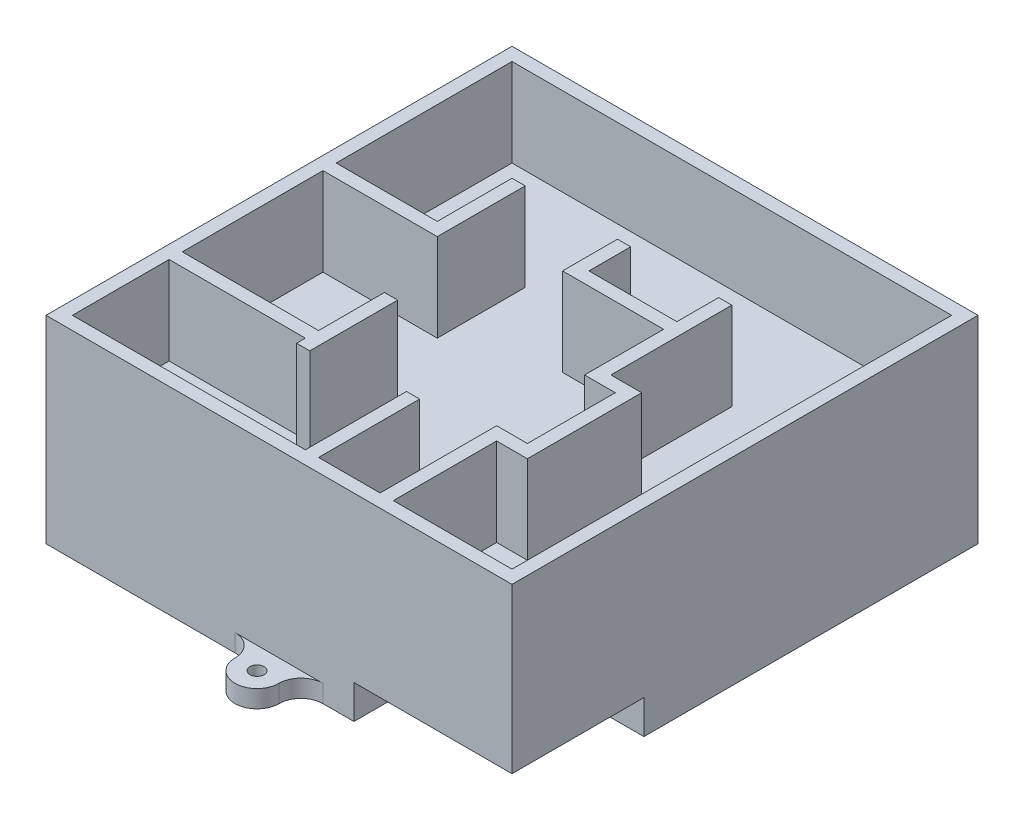
from build123d import *

# Parameters (mm, degrees)
SKETCH2_W           = 106
SKETCH2_H           = 106
SKETCH2_R           = 4
SKETCH2_R_2         = 6
BOSS_EXTRUDE1_DEPTH = 25
SKETCH3_W           = 106
SKETCH3_H           = 106
SKETCH3_W_2         = 100
SKETCH3_H_2         = 100
BOSS_EXTRUDE2_DEPTH = 20
SKETCH5_W           = 3
SKETCH5_H           = 23
BOSS_EXTRUDE3_DEPTH = 20
SKETCH7_W           = 20
SKETCH7_H           = 3
BOSS_EXTRUDE4_DEPTH = 20
SKETCH10_W          = 10
SKETCH10_H          = 4
BOSS_EXTRUDE5_DEPTH = 10
SKETCH11_W          = 10
SKETCH11_H          = 4
BOSS_EXTRUDE6_DEPTH = 10
FILLET2_RADIUS      = 5
FILLET2_LENGTH      = 4
FILLET3_R           = 5
FILLET4_R           = 5
FILLET5_R           = 5
SKETCH13_R          = 1.6
CUT_EXTRUDE2_DEPTH  = 163.397660082
SKETCH14_W          = 35.96051594
SKETCH14_H          = 7.693498276
CUT_EXTRUDE3_DEPTH  = 30


with BuildPart() as part:
    # Sketch2 → Boss-Extrude1 (new body)
    with BuildSketch(Plane(origin=(0, 0, 0), x_dir=(1, 0, 0), z_dir=(0, 1, 0))):
        with Locations((53, 53)):
            Rectangle(SKETCH2_W, SKETCH2_H)
        with Locations(Location((18, 15, 0), (0, 0, 270))):
            Circle(SKETCH2_R, mode=Mode.SUBTRACT)
        with Locations(Location((92, 13.5, 0), (0, 0, 270))):
            Circle(SKETCH2_R_2, mode=Mode.SUBTRACT)
    extrude(amount=BOSS_EXTRUDE1_DEPTH)

    # Sketch3 → Boss-Extrude2 (add)
    with BuildSketch(Plane(origin=(0, 25, 0), x_dir=(1, 0, 0), z_dir=(0, 1, 0))):
        with Locations((53, 53)):
            Rectangle(SKETCH3_W, SKETCH3_H)
        with Locations((53, 53)):
            Rectangle(SKETCH3_W_2, SKETCH3_H_2, mode=Mode.SUBTRACT)
    extrude(amount=BOSS_EXTRUDE2_DEPTH)

    # Sketch5 → Boss-Extrude3 (add)
    with BuildSketch(Plane(origin=(0, 25, 0), x_dir=(1, 0, 0), z_dir=(0, 1, 0))):
        Polygon((3, 28), (3, 25), (34, 25), (34, 23), (37, 23), (37, 43), (34, 43), (34, 28), align=None)
        Polygon((83, 52.5), (83, 26.5), (76, 26.5), (76, 3), (73, 3), (73, 29.5), (80, 29.5), (80, 49.5), (73, 49.5), (73, 52.5), align=None)
        Polygon((3, 63), (3, 60), (29, 60), (29, 80), (26, 80), (26, 63), align=None)
        with Locations((57.5, 14.5)):
            Rectangle(SKETCH5_W, SKETCH5_H)
    extrude(amount=BOSS_EXTRUDE3_DEPTH)

    # Sketch7 → Boss-Extrude4 (add)
    with BuildSketch(Plane(origin=(0, 25, 0), x_dir=(1, 0, 0), z_dir=(0, 1, 0))):
        Polygon((50, 67.496539), (53, 67.496539), (53, 70.496539), (53, 79.996539), (50, 79.996539), align=None)
        with Locations((63, 68.996539)):
            Rectangle(SKETCH7_W, SKETCH7_H)
        Polygon((73, 67.496539), (73, 52.5), (76, 52.5), (76, 80), (73, 80), (73, 70.496539), align=None)
    extrude(amount=BOSS_EXTRUDE4_DEPTH)

    # Sketch10 → Boss-Extrude5 (add)
    with BuildSketch(Plane.XY):
        with Locations((53, 2)):
            Rectangle(SKETCH10_W, SKETCH10_H)
    extrude(amount=BOSS_EXTRUDE5_DEPTH)

    # Sketch11 → Boss-Extrude6 (add)
    with BuildSketch(Plane(origin=(0, 0, -106), x_dir=(-1, 0, 0), z_dir=(0, 0, -1))):
        with Locations((-53, 2)):
            Rectangle(SKETCH11_W, SKETCH11_H)
    extrude(amount=BOSS_EXTRUDE6_DEPTH)

    # Fillet2: full round fillet: the end face becomes a half cylinder, R = half its width
    fillet2_face = Plane((53, 2, -116), x_dir=(0, -1, 0), z_dir=(0, 0, -1))  # on the end face: x along it, z out of the body
    fillet2_slab = fillet2_face.offset(-FILLET2_RADIUS / 2) * Box(FILLET2_LENGTH, 2 * FILLET2_RADIUS, FILLET2_RADIUS, mode=Mode.PRIVATE)  # the body's end, R deep
    fillet2_round = Plane((53, 2, -111), x_dir=(0, 0, -1), z_dir=(0, -1, 0)) * Cylinder(FILLET2_RADIUS, FILLET2_LENGTH, mode=Mode.PRIVATE)  # its axis R under the face
    add(fillet2_slab - fillet2_round, mode=Mode.SUBTRACT)

    # Fillet3
    fillet3_edges = [part.edges().sort_by_distance(p)[0] for p in [
        (48, 2, -106),
        (58, 2, -106),
    ]]
    fillet(fillet3_edges, radius=FILLET3_R - 0.0001)  # a hair under: the kernel refuses the full size

    # Fillet4
    fillet4_edges = [part.edges().sort_by_distance(p)[0] for p in [
        (48, 2, 0),
        (58, 2, 0),
    ]]
    fillet(fillet4_edges, radius=FILLET4_R)

    # Fillet5
    fillet5_edges = [part.edges().sort_by_distance(p)[0] for p in [
        (48, 2, 10),
        (58, 2, 10),
    ]]
    fillet(fillet5_edges, radius=FILLET5_R - 0.0001)  # a hair under: the kernel refuses the full size

    # Sketch13 → Cut-Extrude2 (cut, through all)
    with BuildSketch(Plane(origin=(0, 4, 0), x_dir=(1, 0, 0), z_dir=(0, 1, 0))):
        with Locations(Location((53, -5, 0), (0, 0, 180))):
            Circle(SKETCH13_R)
        with Locations(Location((53, 111, 0), (0, 0, 180))):
            Circle(SKETCH13_R)
    extrude(amount=-CUT_EXTRUDE2_DEPTH, mode=Mode.SUBTRACT)

    # Sketch14 → Cut-Extrude3 (cut)
    with BuildSketch(Plane.XY):
        with Locations((88.01974203, 3.846749138)):
            Rectangle(SKETCH14_W, SKETCH14_H)
    extrude(amount=-CUT_EXTRUDE3_DEPTH, mode=Mode.SUBTRACT)


solid = part.part
